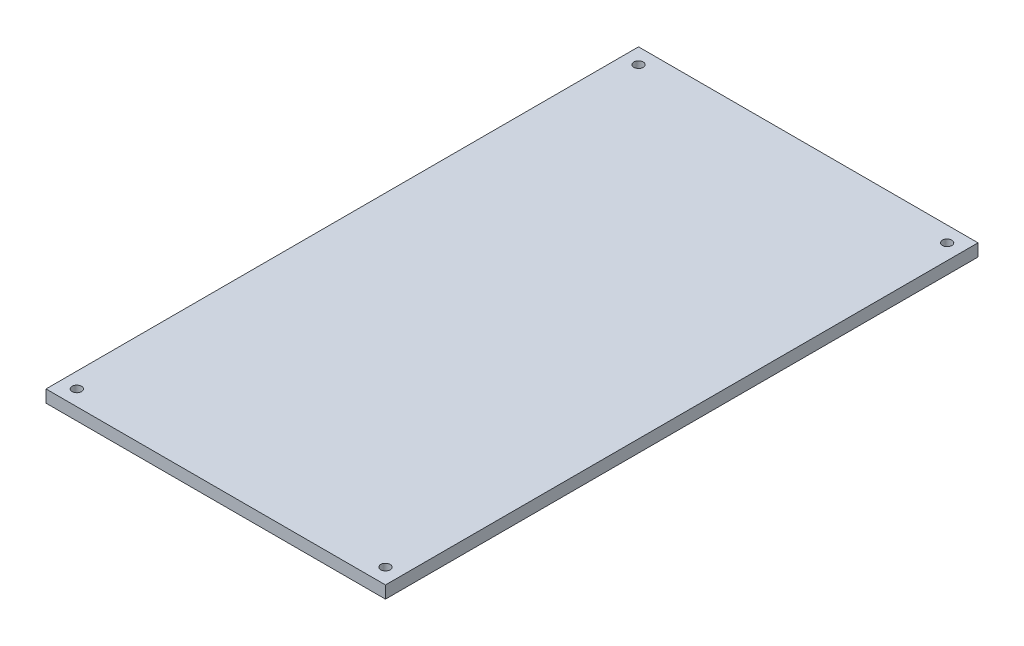
from build123d import *

# Parameters (mm, degrees)
SKETCH2_W           = 55
SKETCH2_H           = 96
BOSS_EXTRUDE1_DEPTH = 2
SKETCH3_R           = 0.762
CUT_EXTRUDE1_DEPTH  = 111.657128103


with BuildPart() as part:
    # Sketch2 → Boss-Extrude1 (new body)
    with BuildSketch(Plane(origin=(0, 0, 0), x_dir=(1, 0, 0), z_dir=(0, 1, 0))):
        with Locations((27.5, 48)):
            Rectangle(SKETCH2_W, SKETCH2_H)
    extrude(amount=BOSS_EXTRUDE1_DEPTH)

    # Sketch3 → Cut-Extrude1 (cut, through all)
    with BuildSketch(Plane(origin=(0, 2, 0), x_dir=(1, 0, 0), z_dir=(0, 1, 0))):
        with Locations((2.5, 2.5)):
            Circle(SKETCH3_R)
        with Locations((52.5, 2.5)):
            Circle(SKETCH3_R)
        with Locations((52.5, 93.5)):
            Circle(SKETCH3_R)
        with Locations((2.5, 93.5)):
            Circle(SKETCH3_R)
    extrude(amount=-CUT_EXTRUDE1_DEPTH, mode=Mode.SUBTRACT)


solid = part.part
